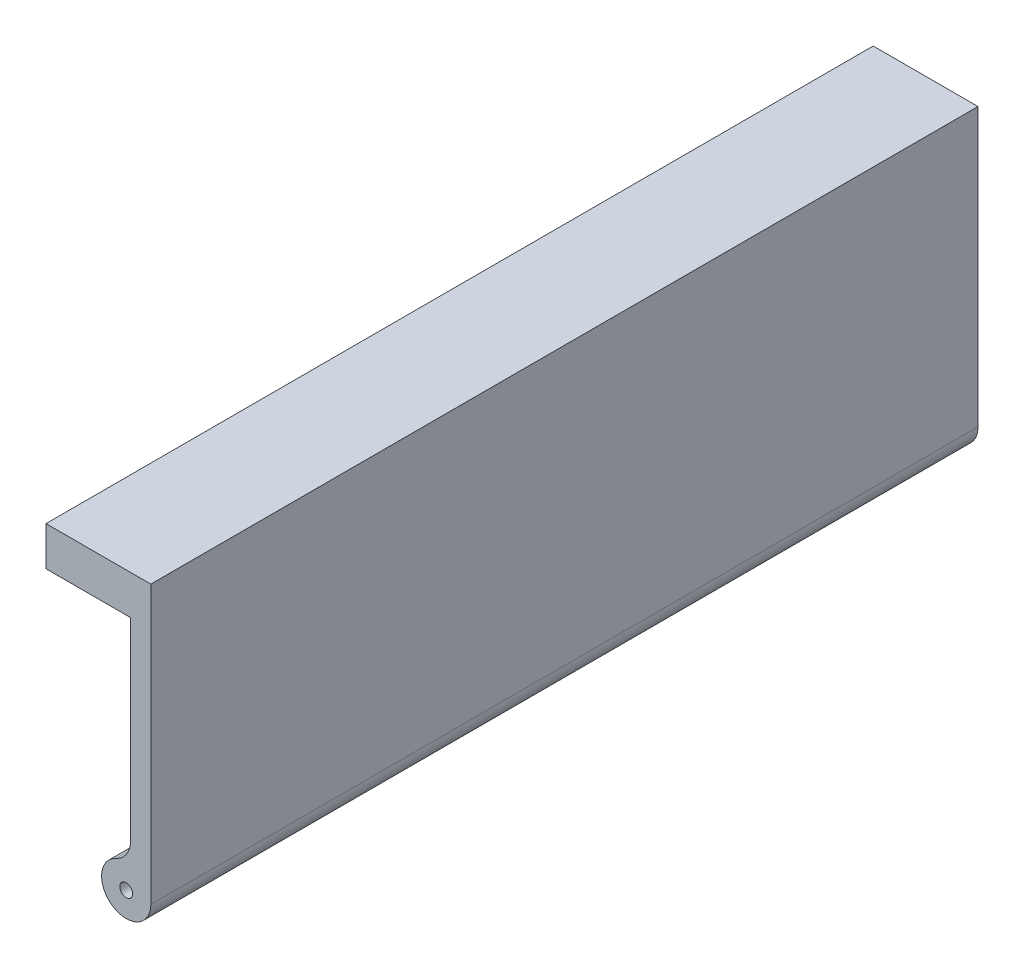
from build123d import *

# Parameters (mm, degrees)
SKETCH1_R           = 0.64
BOSS_EXTRUDE1_DEPTH = 82
SKETCH3_W           = 2
SKETCH3_H           = 82
BOSS_EXTRUDE4_DEPTH = 2.5
SKETCH6_W           = 82
SKETCH6_H           = 3.880734095
BOSS_EXTRUDE5_DEPTH = 8.39


with BuildPart() as part:
    # Sketch1 → Boss-Extrude1 (new body)
    with BuildSketch(Plane.XY):
        with BuildLine():
            Line((2.44, 0), (2.44, 25))
            Line((2.44, 25), (0.44, 25))
            Line((0.44, 25), (0.44, 4.489988864))
            ThreePointArc((0.44, 4.489988864), (0.044314057, 3.140225052), (-1.017489879, 2.217727293))
            ThreePointArc((-1.017489879, 2.217727293), (-1.317369481, -2.05381052), (2.44, 0))
        make_face()
        Circle(SKETCH1_R, mode=Mode.SUBTRACT)
    extrude(amount=BOSS_EXTRUDE1_DEPTH)

    # Sketch3 → Boss-Extrude4 (add)
    with BuildSketch(Plane(origin=(0, 25, 0), x_dir=(1, 0, 0), z_dir=(0, 1, 0))):
        with Locations((1.44, -41)):
            Rectangle(SKETCH3_W, SKETCH3_H)
    extrude(amount=BOSS_EXTRUDE4_DEPTH)

    # Sketch6 → Boss-Extrude5 (add)
    with BuildSketch(Plane.ZY.offset(-0.44)):
        with Locations((41, 25.559632953)):
            Rectangle(SKETCH6_W, SKETCH6_H)
    extrude(amount=BOSS_EXTRUDE5_DEPTH)


solid = part.part
